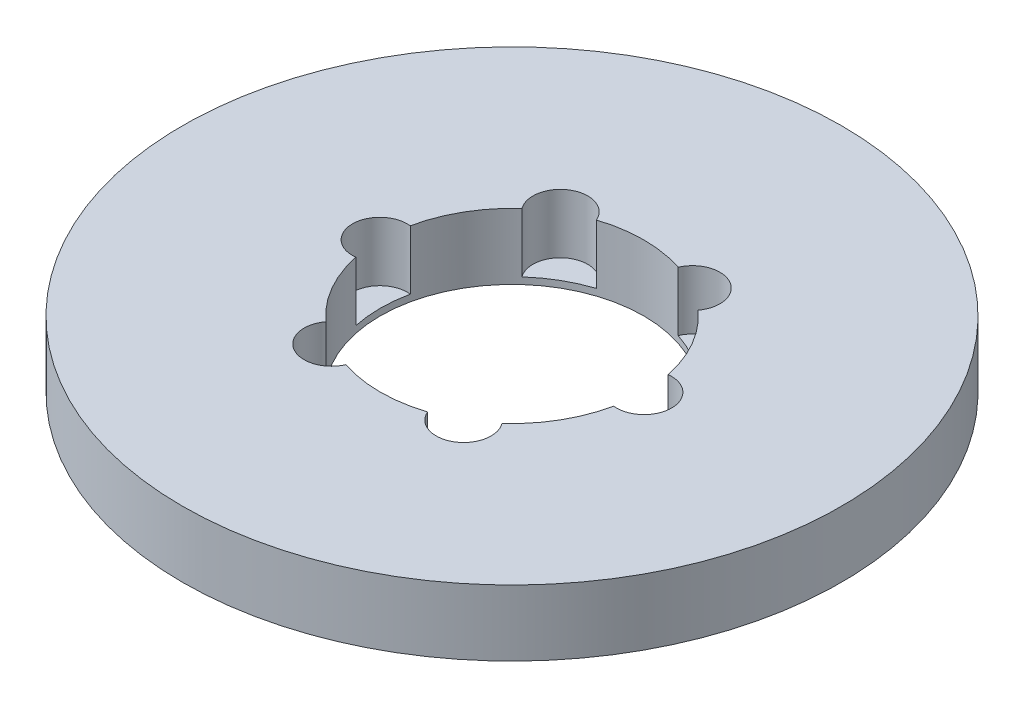
from build123d import *

# Parameters (mm, degrees)
SKETCH1_R           = 75
BOSS_EXTRUDE1_DEPTH = 15
SKETCH2_R           = 30
CUT_EXTRUDE1_DEPTH  = 108.121426428
SKETCH3_R           = 6.246335841
CUT_EXTRUDE2_DEPTH  = 13.482981436
CIRPATTERN1_COUNT   = 6


with BuildPart() as part:
    # Sketch1 → Boss-Extrude1 (new body)
    with BuildSketch(Plane(origin=(0, 0, 0), x_dir=(1, 0, 0), z_dir=(0, 1, 0))):
        Circle(SKETCH1_R)
    extrude(amount=BOSS_EXTRUDE1_DEPTH)

    # Sketch2 → Cut-Extrude1 (cut, through all)
    with BuildSketch(Plane(origin=(0, 0, 0), x_dir=(1, 0, 0), z_dir=(0, 1, 0))):
        Circle(SKETCH2_R)
    extrude(amount=CUT_EXTRUDE1_DEPTH, mode=Mode.SUBTRACT)

    # Sketch3 → Cut-Extrude2 (cut)
    with BuildSketch(Plane(origin=(0, 15, 0), x_dir=(1, 0, 0), z_dir=(0, 1, 0))):
        with Locations((-30.063409109, 0)):
            Circle(SKETCH3_R)
    cut_extrude2 = extrude(amount=-CUT_EXTRUDE2_DEPTH, mode=Mode.SUBTRACT)

    # CirPattern1: Cut-Extrude2 ×6 about axis
    cirpattern1_axis = Axis((0, 0, 0), (0, 1, 0))
    for i in range(1, CIRPATTERN1_COUNT):
        add(cut_extrude2.rotate(cirpattern1_axis, i * 360 / CIRPATTERN1_COUNT), mode=Mode.SUBTRACT)


solid = part.part
